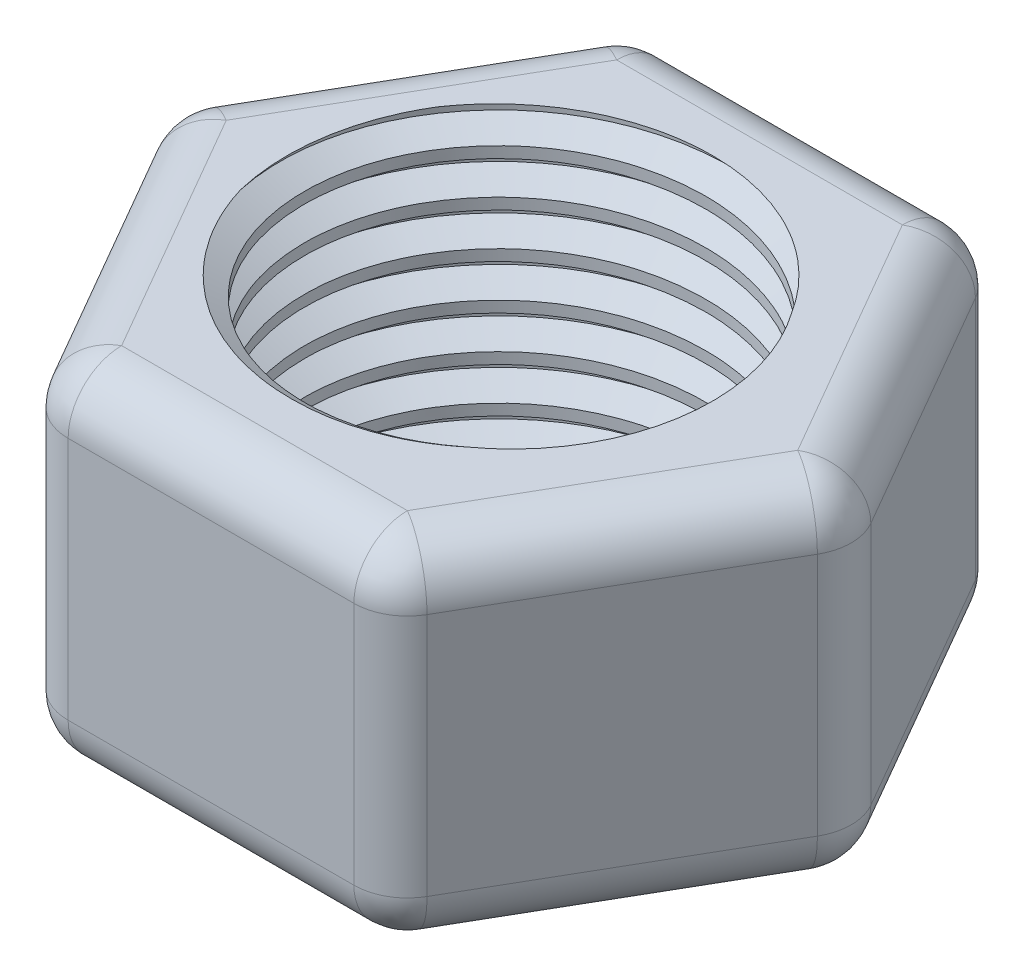
from build123d import *

# Parameters (mm, degrees)
SKETCH1_R           = 4.7625
BOSS_EXTRUDE1_DEPTH = 8.334375
FILLET1_R           = 1.27
THREAD1_PITCH       = 1.058333333


with BuildPart() as part:
    # Sketch1 → Boss-Extrude1 (new body)
    with BuildSketch(Plane(origin=(0, 0, 0), x_dir=(1, 0, 0), z_dir=(0, 1, 0))):
        Polygon((8.248891971, 0), (4.124445986, 7.14375), (-4.124445986, 7.14375), (-8.248891971, 0), (-4.124445986, -7.14375), (4.124445986, -7.14375), align=None)
        with Locations(Location((0, 0, 0), (0, 0, 270))):
            Circle(SKETCH1_R, mode=Mode.SUBTRACT)
    extrude(amount=BOSS_EXTRUDE1_DEPTH)

    # Fillet1
    fillet1_edges = [part.edges().sort_by_distance(p)[0] for p in [
        (4.124445986, 4.1671875, 7.14375),
        (-4.124445986, 4.1671875, 7.14375),
        (-8.248891971, 4.1671875, 0),
        (-4.124445986, 4.1671875, -7.14375),
        (4.124445986, 4.1671875, -7.14375),
        (8.248891971, 4.1671875, 0),
        (0, 8.334375, -7.14375),
        (-6.186668978, 8.334375, -3.571875),
        (-6.186668978, 8.334375, 3.571875),
        (0, 8.334375, 7.14375),
        (6.186668978, 8.334375, 3.571875),
        (0, 0, 7.14375),
        (-6.186668978, 0, 3.571875),
        (-6.186668978, 0, -3.571875),
        (0, 0, -7.14375),
        (6.186668978, 0, -3.571875),
        (6.186668978, 0, 3.571875),
        (6.186668978, 8.334375, -3.571875),
    ]]
    fillet(fillet1_edges, radius=FILLET1_R)

    # Thread1: the profile of Thread Profile1 profile screwed along a right-hand helix of 12 turns, 8 arcs to a turn; built about Z, then put on its axis
    thread1_z = Axis((0, 0, 0), (0, 0, 1))
    thread1_corners = [(4.7622, 0, -0.000173205), (5.335339718, 0, 0.330729165), (5.335339718, 0, 0.463020832), (4.7622, 0, 0.793923202)]
    with BuildLine(mode=Mode.PRIVATE) as thread1_profile:
        Line(thread1_corners[0], thread1_corners[1])
        Line(thread1_corners[1], thread1_corners[2])
        Line(thread1_corners[2], thread1_corners[3])
        Line(thread1_corners[3], thread1_corners[0])
    thread1_cap = Face(thread1_profile.wire())
    thread1_turn_angles = [0, 22.5, 45, 67.5, 90, 112.5, 135, 157.5, 180, 202.5, 225, 247.5, 270, 292.5, 315, 337.5, 360]
    thread1_turn_weights = [1, 0.9238795325112867, 1, 0.9238795325112867, 1, 0.9238795325112867, 1, 0.9238795325112867, 1, 0.9238795325112867, 1, 0.9238795325112867, 1, 0.9238795325112867, 1, 0.9238795325112867, 1]
    thread1_turn_rails = [Edge.make_bspline([Vector(p[0], p[1], 0).rotate(thread1_z, thread1_turn_angles[k]) / thread1_turn_weights[k] + Vector(0, 0, p[2] + THREAD1_PITCH * thread1_turn_angles[k] / 360) for k in range(17)], [0, 0, 0, 1, 1, 2, 2, 3, 3, 4, 4, 5, 5, 6, 6, 7, 7, 8, 8, 8], 2, thread1_turn_weights) for p in thread1_corners]
    thread1_turn_sides = [Face.make_surface_from_curves(thread1_turn_rails[p[0]], thread1_turn_rails[p[1]]) for p in [(0, 1), (1, 2), (2, 3), (3, 0)]]
    thread1 = Plane(origin=(0, 10.874375, 0), x_dir=(-1, 0, 0), z_dir=(0, -1, 0)) * Solid(Shell([*[p.moved(Location((0, 0, THREAD1_PITCH * i))) for i in range(12) for p in thread1_turn_sides], thread1_cap, thread1_cap.rotate(thread1_z, 4320).moved(Location((0, 0, THREAD1_PITCH * 4320 / 360)))]))
    add(thread1, mode=Mode.SUBTRACT)


solid = part.part
